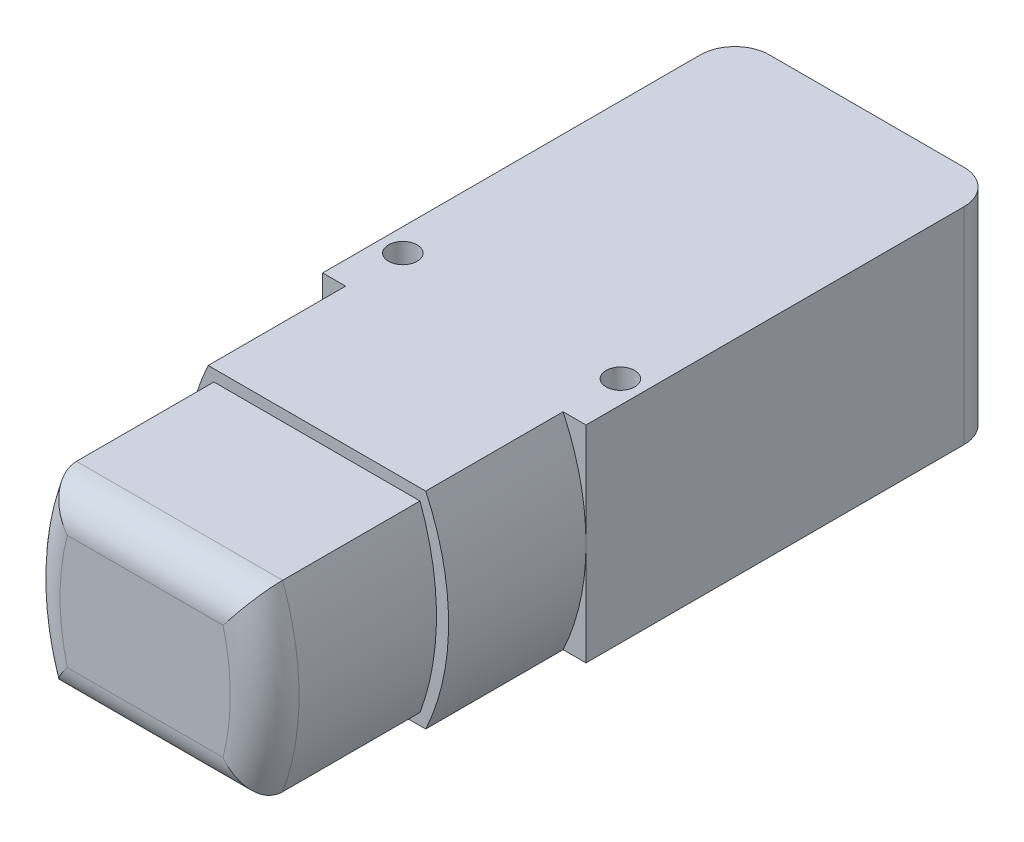
from build123d import *

# Parameters (mm, degrees)
CROQUIS1_W              = 23
CROQUIS1_H              = 18
SALIENTE_EXTRUIR1_DEPTH = 36
REDONDEO1_R             = 3
SALIENTE_EXTRUIR2_DEPTH = 12
SALIENTE_EXTRUIR3_DEPTH = 15
REDONDEO2_R             = 3
CROQUIS8_R              = 1.25
CORTAR_EXTRUIR3_DEPTH   = 67.522552661


with BuildPart() as part:
    # Croquis1 → Saliente-Extruir1 (new body)
    with BuildSketch(Plane.XY):
        Rectangle(CROQUIS1_W, CROQUIS1_H)
    extrude(amount=SALIENTE_EXTRUIR1_DEPTH)

    # Redondeo1
    redondeo1_edges = [part.edges().sort_by_distance(p)[0] for p in [
        (11.5, 0, 0),
        (-11.5, 0, 0),
    ]]
    fillet(redondeo1_edges, radius=REDONDEO1_R)

    # Croquis2 → Saliente-Extruir2 (add)
    with BuildSketch(Plane.XY.offset(36)):
        with BuildLine():
            Line((-9.5, 9), (9.5, 9))
            ThreePointArc((9.5, 9), (11.5, 0), (9.5, -9))
            Line((9.5, -9), (-9.5, -9))
            ThreePointArc((-9.5, -9), (-11.5, 0), (-9.5, 9))
        make_face()
    extrude(amount=SALIENTE_EXTRUIR2_DEPTH)

    # Croquis3 → Saliente-Extruir3 (add)
    with BuildSketch(Plane.XY.offset(48)):
        with BuildLine():
            Line((-9, 8), (9, 8))
            ThreePointArc((9, 8), (10.436141347, 0), (9, -8))
            Line((9, -8), (-9, -8))
            ThreePointArc((-9, -8), (-10.436141347, 0), (-9, 8))
        make_face()
    extrude(amount=SALIENTE_EXTRUIR3_DEPTH)

    # Redondeo2
    redondeo2_edges = [part.edges().sort_by_distance(p)[0] for p in [
        (10.436141347, 0, 63),
        (0, 8, 63),
        (-10.436141347, 0, 63),
        (0, -8, 63),
    ]]
    fillet(redondeo2_edges, radius=REDONDEO2_R)

    # Croquis8 → Cortar-Extruir3 (cut, through all)
    with BuildSketch(Plane.XZ.offset(9)):
        with Locations((-9.5, 31)):
            Circle(CROQUIS8_R)
        with Locations((9.5, 31)):
            Circle(CROQUIS8_R)
    extrude(amount=-CORTAR_EXTRUIR3_DEPTH, mode=Mode.SUBTRACT)


solid = part.part
